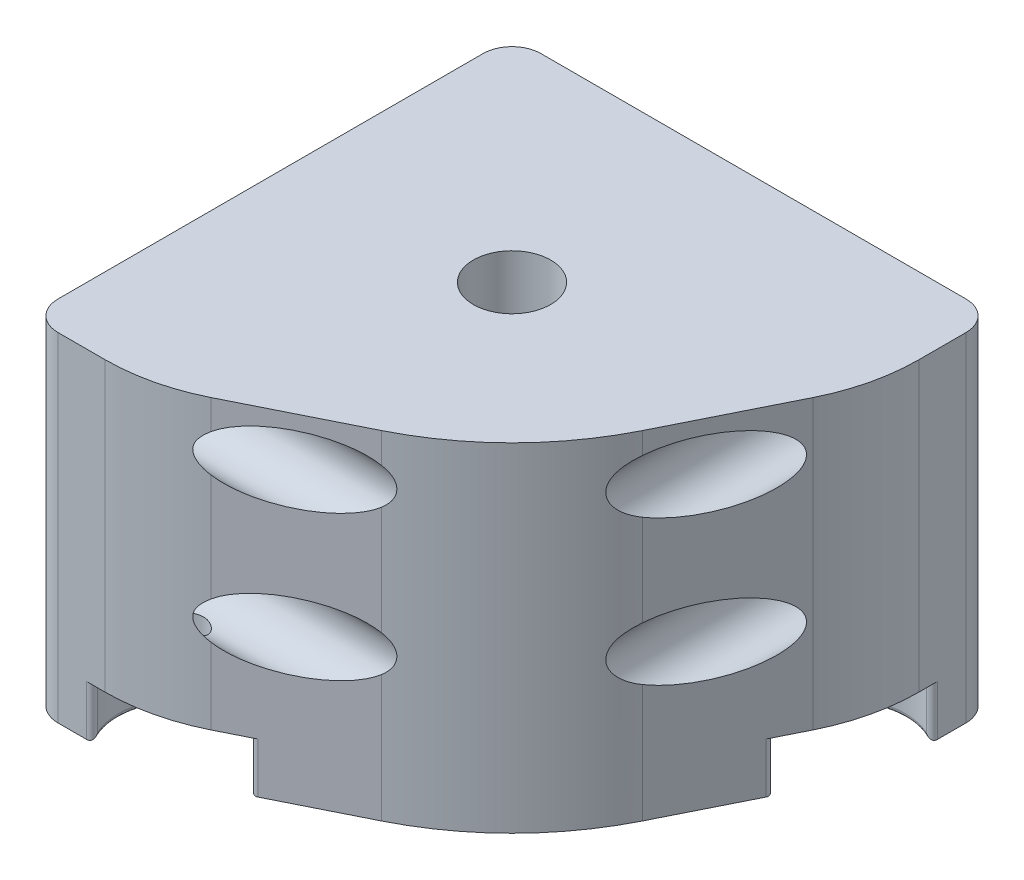
from build123d import *

# Parameters (mm, degrees)
ESQUISSE1_R             = 4
BOSS_EXTRU_1_DEPTH      = 35
ESQUISSE16_R            = 2
ENL_V_MAT_EXTRU_8_DEPTH = 12
ESQUISSE2_R             = 16
ENL_V_MAT_EXTRU_1_DEPTH = 19
ENL_V_MAT_EXTRU_2_REACH = 67.955
ESQUISSE4_R             = 1.5
ENL_V_MAT_EXTRU_3_REACH = 67.955
ESQUISSE5_R             = 1.5
ESQUISSE15_R            = 6.75
ENL_V_MAT_EXTRU_7_DEPTH = 5.2
ENL_V_MAT_EXTRU_5_REACH = 63.53
ESQUISSE11_R            = 3.5
ENL_V_MAT_EXTRU_6_REACH = 63.53
ESQUISSE14_R            = 3.5
CONG_1_2MM_R            = 2
CONG_2_7MM_R            = 7
CONG_4_30MM_R           = 30
CONG_5_20MM_R           = 20
CONG_6_3MM_R            = 3
CONG_8_0_5MM_R          = 0.5


# Some blends are built 0.0001 mm under size
with BuildPart() as part:
    # Esquisse1 → Boss.-Extru.1 (new body)
    with BuildSketch(Plane(origin=(0, 0, 0), x_dir=(1, 0, 0), z_dir=(0, 1, 0))):
        Polygon((-25, 25), (-25, -25), (-12.443650814, -25), (12.556349186, -12.556349186), (25, 12.443650814), (25, 25), align=None)
        with Locations(Location((-3, 3, 0), (0, 0, 270))):
            Circle(ESQUISSE1_R, mode=Mode.SUBTRACT)
    extrude(amount=BOSS_EXTRU_1_DEPTH)

    # Esquisse16 → Enlèv. mat.-Extru.8 (cut)
    with BuildSketch(Plane.XZ):
        with Locations(Location((-12.443650814, 21.5, 0), (0, 0, 270))):
            Circle(ESQUISSE16_R)
        with Locations(Location((21.5, -12.443650814, 0), (0, 0, 270))):
            Circle(ESQUISSE16_R)
    extrude(amount=-ENL_V_MAT_EXTRU_8_DEPTH, mode=Mode.SUBTRACT)

    # Esquisse2 → Enlèv. mat.-Extru.1 (cut)
    with BuildSketch(Plane(origin=(0, 0, 0), x_dir=(1, 0, 0), z_dir=(0, 1, 0))):
        with Locations(Location((-3, 3, 0), (0, 0, 270))):
            Circle(ESQUISSE2_R)
    extrude(amount=ENL_V_MAT_EXTRU_1_DEPTH, mode=Mode.SUBTRACT)

    # Enlèv. mat.-Extru.2: up to this plane
    enl_v_mat_extru_2_end = Plane(origin=(7.502075036, 35, 15.072094092), z_dir=(0.44559860656034184, 0, 0.8952328645841158))
    # Esquisse4 → Enlèv. mat.-Extru.2 (cut, up to the surface)
    with BuildSketch(Plane.ZY.offset(25), mode=Mode.PRIVATE) as enl_v_mat_extru_2_sk1:
        with Locations((20, 30)):
            Circle(ESQUISSE4_R)
    enl_v_mat_extru_2_tool1 = split(extrude(enl_v_mat_extru_2_sk1.sketch, amount=-ENL_V_MAT_EXTRU_2_REACH, mode=Mode.PRIVATE), bisect_by=enl_v_mat_extru_2_end, keep=Keep.BOTH, mode=Mode.PRIVATE)
    add(enl_v_mat_extru_2_tool1.solids().sort_by_distance((-25, 30, 20))[0], mode=Mode.SUBTRACT)
    # Esquisse4 → Enlèv. mat.-Extru.2 (cut, up to the surface)
    with BuildSketch(Plane.ZY.offset(25), mode=Mode.PRIVATE) as enl_v_mat_extru_2_sk2:
        with Locations((20, 15)):
            Circle(ESQUISSE4_R)
    enl_v_mat_extru_2_tool2 = split(extrude(enl_v_mat_extru_2_sk2.sketch, amount=-ENL_V_MAT_EXTRU_2_REACH, mode=Mode.PRIVATE), bisect_by=enl_v_mat_extru_2_end, keep=Keep.BOTH, mode=Mode.PRIVATE)
    add(enl_v_mat_extru_2_tool2.solids().sort_by_distance((-25, 15, 20))[0], mode=Mode.SUBTRACT)

    # Enlèv. mat.-Extru.3: up to this plane
    enl_v_mat_extru_3_end = Plane(origin=(15.072094092, 35, 7.502075036), z_dir=(-0.8952328645841159, 0, -0.4455986065603416))
    # Esquisse5 → Enlèv. mat.-Extru.3 (cut, up to the surface)
    with BuildSketch(Plane(origin=(0, 0, -25), x_dir=(-1, 0, 0), z_dir=(0, 0, -1)), mode=Mode.PRIVATE) as enl_v_mat_extru_3_sk1:
        with Locations((-19.186827359, 30)):
            Circle(ESQUISSE5_R)
    enl_v_mat_extru_3_tool1 = split(extrude(enl_v_mat_extru_3_sk1.sketch, amount=-ENL_V_MAT_EXTRU_3_REACH, mode=Mode.PRIVATE), bisect_by=enl_v_mat_extru_3_end, keep=Keep.BOTH, mode=Mode.PRIVATE)
    add(enl_v_mat_extru_3_tool1.solids().sort_by_distance((19.186827, 30, -25))[0], mode=Mode.SUBTRACT)
    # Esquisse5 → Enlèv. mat.-Extru.3 (cut, up to the surface)
    with BuildSketch(Plane(origin=(0, 0, -25), x_dir=(-1, 0, 0), z_dir=(0, 0, -1)), mode=Mode.PRIVATE) as enl_v_mat_extru_3_sk2:
        with Locations((-19.186827359, 15)):
            Circle(ESQUISSE5_R)
    enl_v_mat_extru_3_tool2 = split(extrude(enl_v_mat_extru_3_sk2.sketch, amount=-ENL_V_MAT_EXTRU_3_REACH, mode=Mode.PRIVATE), bisect_by=enl_v_mat_extru_3_end, keep=Keep.BOTH, mode=Mode.PRIVATE)
    add(enl_v_mat_extru_3_tool2.solids().sort_by_distance((19.186827, 15, -25))[0], mode=Mode.SUBTRACT)

    # Esquisse15 → Enlèv. mat.-Extru.7 (cut)
    with BuildSketch(Plane.XZ):
        with Locations((-12.443650814, 21.5)):
            Circle(ESQUISSE15_R)
        with Locations((21.5, -12.443650814)):
            Circle(ESQUISSE15_R)
    extrude(amount=-ENL_V_MAT_EXTRU_7_DEPTH, mode=Mode.SUBTRACT)

    # Enlèv. mat.-Extru.5: up to this plane
    enl_v_mat_extru_5_end = Plane(origin=(7.502075036, 35, 15.072094092), z_dir=(0.44559860656034184, 0, 0.8952328645841158))
    # Esquisse11 → Enlèv. mat.-Extru.5 (cut, up to the surface)
    with BuildSketch(Plane(origin=(-19, 0, 0), x_dir=(0, 0, -1), z_dir=(1, 0, 0)), mode=Mode.PRIVATE) as enl_v_mat_extru_5_sk1:
        with Locations(Location((-20, 30, 0), (0, 0, 180))):
            Circle(ESQUISSE11_R)
    enl_v_mat_extru_5_tool1 = split(extrude(enl_v_mat_extru_5_sk1.sketch, amount=ENL_V_MAT_EXTRU_5_REACH, mode=Mode.PRIVATE), bisect_by=enl_v_mat_extru_5_end, keep=Keep.BOTH, mode=Mode.PRIVATE)
    add(enl_v_mat_extru_5_tool1.solids().sort_by_distance((-19, 30, 20))[0], mode=Mode.SUBTRACT)
    # Esquisse11 → Enlèv. mat.-Extru.5 (cut, up to the surface)
    with BuildSketch(Plane(origin=(-19, 0, 0), x_dir=(0, 0, -1), z_dir=(1, 0, 0)), mode=Mode.PRIVATE) as enl_v_mat_extru_5_sk2:
        with Locations(Location((-20, 15, 0), (0, 0, 180))):
            Circle(ESQUISSE11_R)
    enl_v_mat_extru_5_tool2 = split(extrude(enl_v_mat_extru_5_sk2.sketch, amount=ENL_V_MAT_EXTRU_5_REACH, mode=Mode.PRIVATE), bisect_by=enl_v_mat_extru_5_end, keep=Keep.BOTH, mode=Mode.PRIVATE)
    add(enl_v_mat_extru_5_tool2.solids().sort_by_distance((-19, 15, 20))[0], mode=Mode.SUBTRACT)

    # Enlèv. mat.-Extru.6: up to this plane
    enl_v_mat_extru_6_end = Plane(origin=(15.072094092, 35, 7.502075036), z_dir=(-0.8952328645841159, 0, -0.4455986065603416))
    # Esquisse14 → Enlèv. mat.-Extru.6 (cut, up to the surface)
    with BuildSketch(Plane(origin=(0, 0, -19), x_dir=(-1, 0, 0), z_dir=(0, 0, -1)), mode=Mode.PRIVATE) as enl_v_mat_extru_6_sk1:
        with Locations(Location((-19.186827359, 30, 0), (0, 0, 90))):
            Circle(ESQUISSE14_R)
    enl_v_mat_extru_6_tool1 = split(extrude(enl_v_mat_extru_6_sk1.sketch, amount=-ENL_V_MAT_EXTRU_6_REACH, mode=Mode.PRIVATE), bisect_by=enl_v_mat_extru_6_end, keep=Keep.BOTH, mode=Mode.PRIVATE)
    add(enl_v_mat_extru_6_tool1.solids().sort_by_distance((19.186827, 30, -19))[0], mode=Mode.SUBTRACT)
    # Esquisse14 → Enlèv. mat.-Extru.6 (cut, up to the surface)
    with BuildSketch(Plane(origin=(0, 0, -19), x_dir=(-1, 0, 0), z_dir=(0, 0, -1)), mode=Mode.PRIVATE) as enl_v_mat_extru_6_sk2:
        with Locations(Location((-19.186827359, 15, 0), (0, 0, 90))):
            Circle(ESQUISSE14_R)
    enl_v_mat_extru_6_tool2 = split(extrude(enl_v_mat_extru_6_sk2.sketch, amount=-ENL_V_MAT_EXTRU_6_REACH, mode=Mode.PRIVATE), bisect_by=enl_v_mat_extru_6_end, keep=Keep.BOTH, mode=Mode.PRIVATE)
    add(enl_v_mat_extru_6_tool2.solids().sort_by_distance((19.186827, 15, -19))[0], mode=Mode.SUBTRACT)

    # Congé 1 2mm
    cong_1_2mm_edges = [part.edges().sort_by_distance(p)[0] for p in [
        (-3, 0, -19),
        (-3, 19, -19),
    ]]
    fillet(cong_1_2mm_edges, radius=CONG_1_2MM_R)

    # Congé 2 7mm
    cong_2_7mm_edges = [part.edges().sort_by_distance(p)[0] for p in [
        (-3, 19, -7),
    ]]
    fillet(cong_2_7mm_edges, radius=CONG_2_7MM_R)

    # Congé 4 30mm
    # the kernel refuses this fillet: 30 mm, written as the material it takes off along each edge
    with BuildSketch(Plane(origin=(12.556349186, -25.15049063, 12.556349186), x_dir=(-0.895232864584116, 0, 0.4455986065603412), z_dir=(0, 1, 0))) as cong_4_30mm_piece_1:
        with BuildLine():
            CenterArc((CONG_4_30MM_R * 0.33533987507, -CONG_4_30MM_R), CONG_4_30MM_R, 90, 37.076712398)
            Line((-CONG_4_30MM_R * 0.267543888593, -CONG_4_30MM_R * 0.202170965989), (0, 0))
            Line((0, 0), (CONG_4_30MM_R * 0.33533987507, 0))
        make_face()
    extrude(amount=85.300981261, mode=Mode.SUBTRACT)

    # Congé 5 20mm
    # the kernel refuses this fillet: 20 mm, written as the material it takes off along each edge
    with BuildSketch(Plane(origin=(-12.443650814, -6.555774578, 25), x_dir=(0.8952328645841151, 0, -0.445598606560343), z_dir=(0, 1, 0)), Plane(origin=(25, -6.555774578, -12.443650814), x_dir=(0, 0, -1), z_dir=(0, 1, 0))) as cong_5_20mm_piece_1:
        with BuildLine():
            CenterArc((CONG_5_20MM_R * 0.235115491551, CONG_5_20MM_R), CONG_5_20MM_R, 243.538356199, 26.461643801)
            Line((-CONG_5_20MM_R * 0.210483115009, CONG_5_20MM_R * 0.104767135416), (0, 0))
            Line((0, 0), (CONG_5_20MM_R * 0.235115491551, 0))
        make_face()
    extrude(amount=53.311549155, mode=Mode.SUBTRACT)

    # Congé 6 3mm
    cong_6_3mm_edges = [part.edges().sort_by_distance(p)[0] for p in [
        (-25, 17.5, 25),
        (-25, 17.5, -25),
        (25, 17.5, -25),
    ]]
    fillet(cong_6_3mm_edges, radius=CONG_6_3MM_R)

    # Congé 8 0.5mm
    cong_8_0_5mm_edges = [part.edges().sort_by_distance(p)[0] for p in [
        (-25, 30, 18.5),
        (-25, 15, 18.5),
        (20.686827359, 30, -25),
        (20.686827359, 15, -25),
        (-5.69512253, 2.6, 21.640946821),
        (-14.192753104, 0, 14.980556682),
        (-18.215349004, 2.6, 25),
        (21.640946821, 2.6, -5.69512253),
        (25, 2.6, -18.215349004),
        (14.980556682, 0, -14.192753104),
    ]]
    fillet(cong_8_0_5mm_edges, radius=CONG_8_0_5MM_R - 0.0001)  # a hair under: the kernel refuses the full size


solid = part.part
